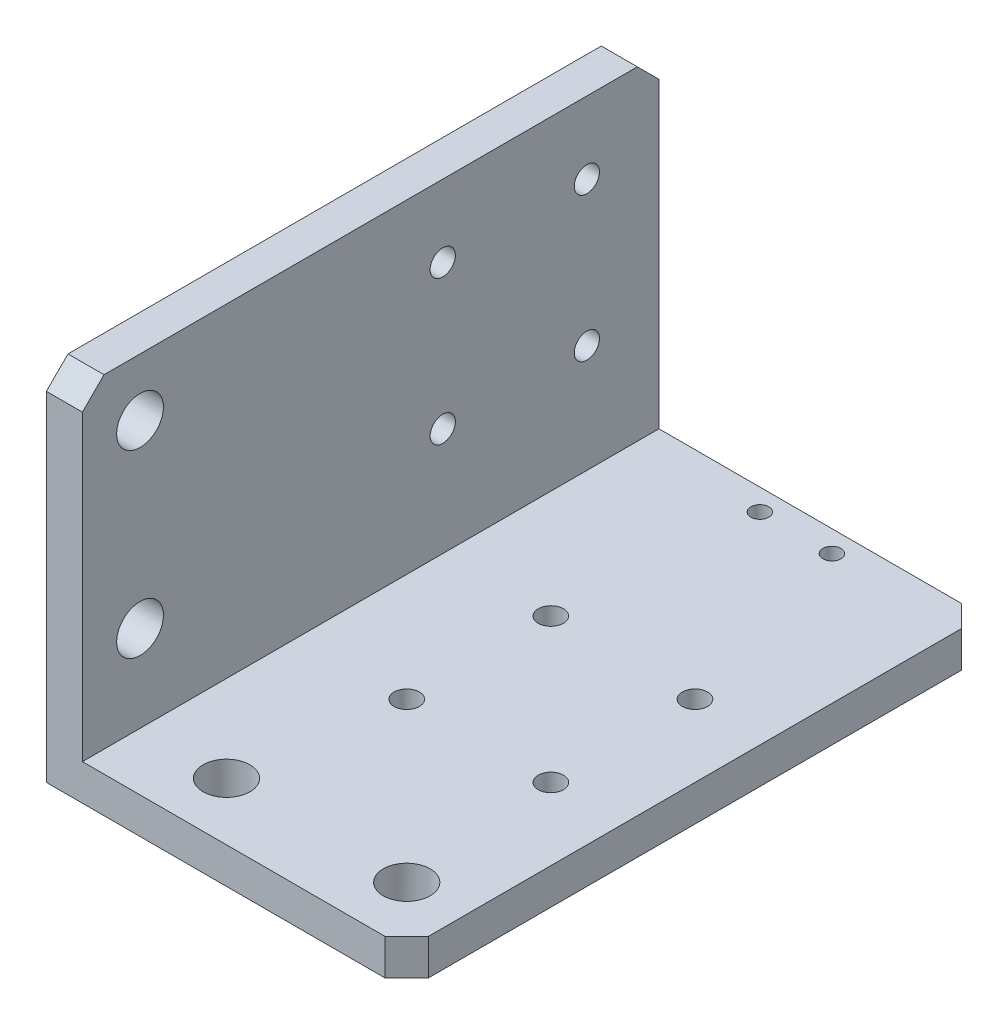
from build123d import *

# Parameters (mm, degrees)
ESTRUSIONE_ESTRUSIONE1_DEPTH = 80
FORO_6_5_6_5_1_D             = 6.5
FORO_6_5_6_5_2_D             = 6.5
FORO_6_5_6_5_2_DEPTH         = 5
FORO_6_5_6_5_2_TIP           = 1.952797012
TAGLIO_ESTRUSIONE3_REACH     = 108.771
SCHIZZO10_R                  = 1.75
TAGLIO_ESTRUSIONE4_REACH     = 108.771
SCHIZZO11_R                  = 1.75
SMUSSO1_SIZE                 = 3
TAGLIO_ESTRUSIONE5_REACH     = 106.523
SCHIZZO12_R                  = 1.25


with BuildPart() as part:
    # Schizzo1 → Estrusione-Estrusione1 (new body)
    with BuildSketch(Plane.XY):
        Polygon((0, 0), (0, 50), (5, 50), (5, 5), (50, 5), (50, 0), align=None)
    extrude(amount=ESTRUSIONE_ESTRUSIONE1_DEPTH)

    # Foro Ø6.5 (6.5)-1 (through all)
    with Locations(Plane(origin=(0, 0, 0), x_dir=(-1, 0, 0), z_dir=(0, -1, 0))):
        with Locations((-17, -72), (-42, -72)):
            Hole(FORO_6_5_6_5_1_D / 2)

    # Foro Ø6.5 (6.5)-2
    with Locations(Plane.ZY):
        with Locations((72, 42), (72, 17)):
            Hole(FORO_6_5_6_5_2_D / 2, depth=FORO_6_5_6_5_2_DEPTH)
            with Locations((0, 0, -(FORO_6_5_6_5_2_DEPTH + FORO_6_5_6_5_2_TIP / 2))):  # 118° drill point
                Cone(0, FORO_6_5_6_5_2_D / 2, FORO_6_5_6_5_2_TIP, mode=Mode.SUBTRACT)

    # Schizzo10 → Taglio-Estrusione3 (cut, up to next)
    with BuildSketch(Plane.ZY, mode=Mode.PRIVATE) as taglio_estrusione3_sk1:
        with Locations((10, 40)):
            Circle(SCHIZZO10_R)
    taglio_estrusione3_tool1 = extrude(taglio_estrusione3_sk1.sketch, amount=-TAGLIO_ESTRUSIONE3_REACH, mode=Mode.PRIVATE) & part.part
    # Schizzo10 → Taglio-Estrusione3 (cut, up to next)
    with BuildSketch(Plane.ZY, mode=Mode.PRIVATE) as taglio_estrusione3_sk2:
        with Locations((30, 40)):
            Circle(SCHIZZO10_R)
    taglio_estrusione3_tool2 = extrude(taglio_estrusione3_sk2.sketch, amount=-TAGLIO_ESTRUSIONE3_REACH, mode=Mode.PRIVATE) & part.part
    # Schizzo10 → Taglio-Estrusione3 (cut, up to next)
    with BuildSketch(Plane.ZY, mode=Mode.PRIVATE) as taglio_estrusione3_sk3:
        with Locations((30, 20)):
            Circle(SCHIZZO10_R)
    taglio_estrusione3_tool3 = extrude(taglio_estrusione3_sk3.sketch, amount=-TAGLIO_ESTRUSIONE3_REACH, mode=Mode.PRIVATE) & part.part
    # Schizzo10 → Taglio-Estrusione3 (cut, up to next)
    with BuildSketch(Plane.ZY, mode=Mode.PRIVATE) as taglio_estrusione3_sk4:
        with Locations((10, 20)):
            Circle(SCHIZZO10_R)
    taglio_estrusione3_tool4 = extrude(taglio_estrusione3_sk4.sketch, amount=-TAGLIO_ESTRUSIONE3_REACH, mode=Mode.PRIVATE) & part.part
    add(taglio_estrusione3_tool1.solids().sort_by_distance((0, 40, 10))[0], mode=Mode.SUBTRACT)
    add(taglio_estrusione3_tool2.solids().sort_by_distance((0, 40, 30))[0], mode=Mode.SUBTRACT)
    add(taglio_estrusione3_tool3.solids().sort_by_distance((0, 20, 30))[0], mode=Mode.SUBTRACT)
    add(taglio_estrusione3_tool4.solids().sort_by_distance((0, 20, 10))[0], mode=Mode.SUBTRACT)

    # Schizzo11 → Taglio-Estrusione4 (cut, up to next)
    with BuildSketch(Plane.XZ, mode=Mode.PRIVATE) as taglio_estrusione4_sk1:
        with Locations((20, 30)):
            Circle(SCHIZZO11_R)
    taglio_estrusione4_tool1 = extrude(taglio_estrusione4_sk1.sketch, amount=-TAGLIO_ESTRUSIONE4_REACH, mode=Mode.PRIVATE) & part.part
    # Schizzo11 → Taglio-Estrusione4 (cut, up to next)
    with BuildSketch(Plane.XZ, mode=Mode.PRIVATE) as taglio_estrusione4_sk2:
        with Locations((20, 50)):
            Circle(SCHIZZO11_R)
    taglio_estrusione4_tool2 = extrude(taglio_estrusione4_sk2.sketch, amount=-TAGLIO_ESTRUSIONE4_REACH, mode=Mode.PRIVATE) & part.part
    # Schizzo11 → Taglio-Estrusione4 (cut, up to next)
    with BuildSketch(Plane.XZ, mode=Mode.PRIVATE) as taglio_estrusione4_sk3:
        with Locations((40, 50)):
            Circle(SCHIZZO11_R)
    taglio_estrusione4_tool3 = extrude(taglio_estrusione4_sk3.sketch, amount=-TAGLIO_ESTRUSIONE4_REACH, mode=Mode.PRIVATE) & part.part
    # Schizzo11 → Taglio-Estrusione4 (cut, up to next)
    with BuildSketch(Plane.XZ, mode=Mode.PRIVATE) as taglio_estrusione4_sk4:
        with Locations((40, 30)):
            Circle(SCHIZZO11_R)
    taglio_estrusione4_tool4 = extrude(taglio_estrusione4_sk4.sketch, amount=-TAGLIO_ESTRUSIONE4_REACH, mode=Mode.PRIVATE) & part.part
    add(taglio_estrusione4_tool1.solids().sort_by_distance((20, 0, 30))[0], mode=Mode.SUBTRACT)
    add(taglio_estrusione4_tool2.solids().sort_by_distance((20, 0, 50))[0], mode=Mode.SUBTRACT)
    add(taglio_estrusione4_tool3.solids().sort_by_distance((40, 0, 50))[0], mode=Mode.SUBTRACT)
    add(taglio_estrusione4_tool4.solids().sort_by_distance((40, 0, 30))[0], mode=Mode.SUBTRACT)

    # Smusso1
    smusso1_edges = [part.edges().sort_by_distance(p)[0] for p in [
        (2.5, 50, 0),
        (50, 2.5, 0),
        (2.5, 50, 80),
        (50, 2.5, 80),
    ]]
    chamfer(smusso1_edges, length=SMUSSO1_SIZE)

    # Schizzo12 → Taglio-Estrusione5 (cut, up to next)
    with BuildSketch(Plane(origin=(0, 5, 0), x_dir=(1, 0, 0), z_dir=(0, 1, 0)), mode=Mode.PRIVATE) as taglio_estrusione5_sk1:
        with Locations((32, -3)):
            Circle(SCHIZZO12_R)
    taglio_estrusione5_tool1 = extrude(taglio_estrusione5_sk1.sketch, amount=-TAGLIO_ESTRUSIONE5_REACH, mode=Mode.PRIVATE) & part.part
    # Schizzo12 → Taglio-Estrusione5 (cut, up to next)
    with BuildSketch(Plane(origin=(0, 5, 0), x_dir=(1, 0, 0), z_dir=(0, 1, 0)), mode=Mode.PRIVATE) as taglio_estrusione5_sk2:
        with Locations((22, -3)):
            Circle(SCHIZZO12_R)
    taglio_estrusione5_tool2 = extrude(taglio_estrusione5_sk2.sketch, amount=-TAGLIO_ESTRUSIONE5_REACH, mode=Mode.PRIVATE) & part.part
    add(taglio_estrusione5_tool1.solids().sort_by_distance((32, 5, 3))[0], mode=Mode.SUBTRACT)
    add(taglio_estrusione5_tool2.solids().sort_by_distance((22, 5, 3))[0], mode=Mode.SUBTRACT)


solid = part.part
